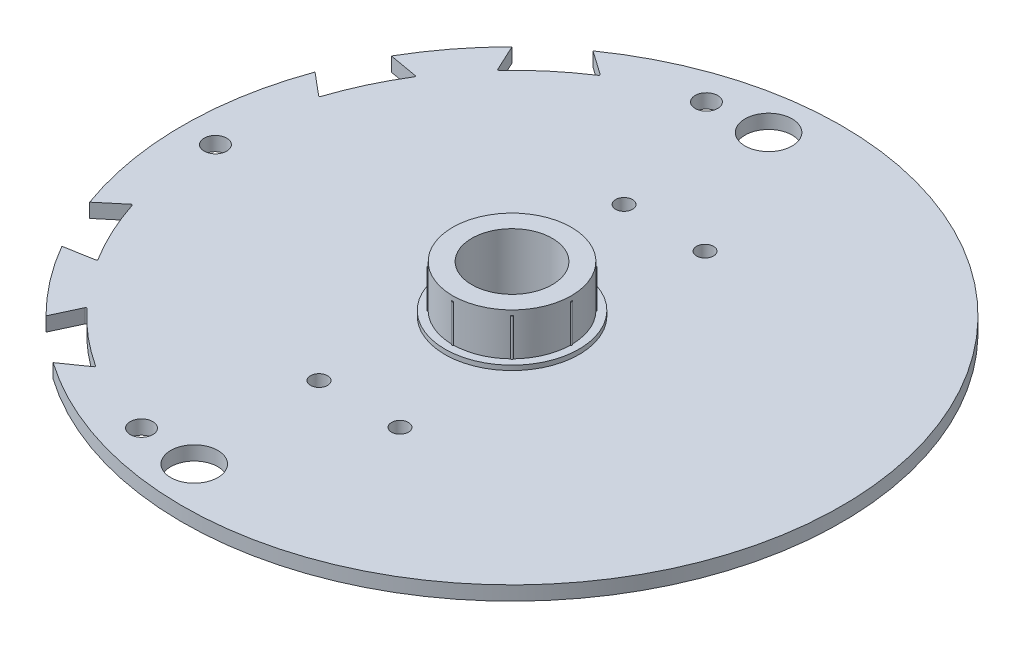
from build123d import *

# Parameters (mm, degrees)
SKETCH1_R                      = 70
BASE_PLATE_DEPTH               = 3
SKETCH2_R                      = 14.25
BEARING_STEPUP_DEPTH           = 1
SKETCH3_R                      = 12.6
BEARING_SITTING_DEPTH          = 9
SKETCH4_R                      = 0.2
BEARING_SITTING_GRID_DEPTH     = 8
SKETCH5_R                      = 2.4
M4_SCREW_CLEARANCE_HOLES_DEPTH = 100.844879688
SKETCH6_R                      = 5
HOLES_RESERVED_FOR_RODS_DEPTH  = 100.844879688
SKETCH8_R                      = 8.55
CUT_EXTRUDE1_DEPTH             = 100.844879688
CUT_EXTRUDE2_REACH             = 101.499
SKETCH9_R                      = 1.8
CUT_EXTRUDE3_DEPTH             = 100.498743711


with BuildPart() as part:
    # Sketch1 → base-plate (new body)
    with BuildSketch(Plane(origin=(0, 0, 0), x_dir=(1, 0, 0), z_dir=(0, 1, 0))):
        Circle(SKETCH1_R)
    extrude(amount=BASE_PLATE_DEPTH)

    # Sketch2 → bearing-stepup (add)
    with BuildSketch(Plane(origin=(0, 3, 0), x_dir=(1, 0, 0), z_dir=(0, 1, 0))):
        Circle(SKETCH2_R)
    extrude(amount=BEARING_STEPUP_DEPTH)

    # Sketch3 → bearing-sitting (add)
    with BuildSketch(Plane(origin=(0, 4, 0), x_dir=(1, 0, 0), z_dir=(0, 1, 0))):
        Circle(SKETCH3_R)
    extrude(amount=BEARING_SITTING_DEPTH)

    # Sketch4 → bearing-sitting-grid (add)
    with BuildSketch(Plane(origin=(0, 4, 0), x_dir=(1, 0, 0), z_dir=(0, 1, 0))):
        with Locations((0, 12.6)):
            Circle(SKETCH4_R)
        with Locations((8.909545443, 8.909545443)):
            Circle(SKETCH4_R)
        with Locations((12.6, 0)):
            Circle(SKETCH4_R)
        with Locations((8.909545443, -8.909545443)):
            Circle(SKETCH4_R)
        with Locations((0, -12.6)):
            Circle(SKETCH4_R)
        with Locations((-8.909545443, -8.909545443)):
            Circle(SKETCH4_R)
        with Locations((-12.6, 0)):
            Circle(SKETCH4_R)
        with Locations((-8.909545443, 8.909545443)):
            Circle(SKETCH4_R)
    extrude(amount=BEARING_SITTING_GRID_DEPTH)

    # Sketch5 → m4-screw-clearance-holes (cut, through all)
    with BuildSketch(Plane.XZ):
        with Locations((-18.7, 60)):
            Circle(SKETCH5_R)
        with Locations((-63, 0)):
            Circle(SKETCH5_R)
        with Locations((-18.7, -60)):
            Circle(SKETCH5_R)
    extrude(amount=-M4_SCREW_CLEARANCE_HOLES_DEPTH, mode=Mode.SUBTRACT)

    # Sketch6 → holes-reserved-for-rods (cut, through all)
    with BuildSketch(Plane.XZ):
        with Locations((-6.5, 61)):
            Circle(SKETCH6_R)
        with Locations((-6.5, -61)):
            Circle(SKETCH6_R)
    extrude(amount=-HOLES_RESERVED_FOR_RODS_DEPTH, mode=Mode.SUBTRACT)

    # Sketch8 → Cut-Extrude1 (cut, through all)
    with BuildSketch(Plane(origin=(0, 13, 0), x_dir=(1, 0, 0), z_dir=(0, 1, 0))):
        Circle(SKETCH8_R)
    extrude(amount=-CUT_EXTRUDE1_DEPTH, mode=Mode.SUBTRACT)

    # Sketch9 → Cut-Extrude2 (cut, up to next)
    with BuildSketch(Plane(origin=(0, 3, 0), x_dir=(1, 0, 0), z_dir=(0, 1, 0)), mode=Mode.PRIVATE) as cut_extrude2_sk1:
        with Locations((-8.6, 32.4)):
            Circle(SKETCH9_R)
    cut_extrude2_tool1 = extrude(cut_extrude2_sk1.sketch, amount=-CUT_EXTRUDE2_REACH, mode=Mode.PRIVATE) & part.part
    # Sketch9 → Cut-Extrude2 (cut, up to next)
    with BuildSketch(Plane(origin=(0, 3, 0), x_dir=(1, 0, 0), z_dir=(0, 1, 0)), mode=Mode.PRIVATE) as cut_extrude2_sk2:
        with Locations((8.6, 32.4)):
            Circle(SKETCH9_R)
    cut_extrude2_tool2 = extrude(cut_extrude2_sk2.sketch, amount=-CUT_EXTRUDE2_REACH, mode=Mode.PRIVATE) & part.part
    # Sketch9 → Cut-Extrude2 (cut, up to next)
    with BuildSketch(Plane(origin=(0, 3, 0), x_dir=(1, 0, 0), z_dir=(0, 1, 0)), mode=Mode.PRIVATE) as cut_extrude2_sk3:
        with Locations((8.6, -32.4)):
            Circle(SKETCH9_R)
    cut_extrude2_tool3 = extrude(cut_extrude2_sk3.sketch, amount=-CUT_EXTRUDE2_REACH, mode=Mode.PRIVATE) & part.part
    # Sketch9 → Cut-Extrude2 (cut, up to next)
    with BuildSketch(Plane(origin=(0, 3, 0), x_dir=(1, 0, 0), z_dir=(0, 1, 0)), mode=Mode.PRIVATE) as cut_extrude2_sk4:
        with Locations((-8.6, -32.4)):
            Circle(SKETCH9_R)
    cut_extrude2_tool4 = extrude(cut_extrude2_sk4.sketch, amount=-CUT_EXTRUDE2_REACH, mode=Mode.PRIVATE) & part.part
    add(cut_extrude2_tool1.solids().sort_by_distance((-8.6, 3, -32.4))[0], mode=Mode.SUBTRACT)
    add(cut_extrude2_tool2.solids().sort_by_distance((8.6, 3, -32.4))[0], mode=Mode.SUBTRACT)
    add(cut_extrude2_tool3.solids().sort_by_distance((8.6, 3, 32.4))[0], mode=Mode.SUBTRACT)
    add(cut_extrude2_tool4.solids().sort_by_distance((-8.6, 3, 32.4))[0], mode=Mode.SUBTRACT)

    # Sketch10 → Cut-Extrude3 (cut, through all)
    with BuildSketch(Plane(origin=(0, 3, 0), x_dir=(1, 0, 0), z_dir=(0, 1, 0))):
        with BuildLine():
            Line((-35.036750707, 53.76592401), (-40.233330852, 57.4046086))
            ThreePointArc((-40.233330852, 57.4046086), (-45.059411439, 53.699715463), (-49.546059024, 49.590301826))
            Line((-49.546059024, 49.590301826), (-46.865030901, 43.840818462))
            ThreePointArc((-46.865030901, 43.840818462), (-46.715497934, 43.72787491), (-46.538110157, 43.788289565))
            ThreePointArc((-46.538110157, 43.788289565), (-41.074128259, 48.950239915), (-35.041789034, 53.434848379))
            ThreePointArc((-35.041789034, 53.434848379), (-34.951489149, 53.599050343), (-35.036750707, 53.76592401))
        make_face()
        with BuildLine():
            Line((-65.861746267, 24.005007365), (-61.002072937, 19.927257266))
            ThreePointArc((-61.002072937, 19.927257266), (-60.818818038, 19.888091008), (-60.68358245, 20.017812594))
            ThreePointArc((-60.68358245, 20.017812594), (-57.913067592, 27.005306925), (-54.341189011, 33.619119216))
            ThreePointArc((-54.341189011, 33.619119216), (-54.328744272, 33.806099114), (-54.476541344, 33.921304927))
            Line((-54.476541344, 33.921304927), (-60.724016952, 35.022903438))
            ThreePointArc((-60.724016952, 35.022903438), (-63.532175871, 29.625540148), (-65.861746267, 24.005007365))
        make_face()
        with BuildLine():
            Line((-46.865030901, -43.840818462), (-49.546059024, -49.590301826))
            ThreePointArc((-49.546059024, -49.590301826), (-45.059411439, -53.699715463), (-40.233330852, -57.4046086))
            Line((-40.233330852, -57.4046086), (-35.036750707, -53.76592401))
            ThreePointArc((-35.036750707, -53.76592401), (-34.951489149, -53.599050343), (-35.041789034, -53.434848379))
            ThreePointArc((-35.041789034, -53.434848379), (-41.074128259, -48.950239915), (-46.538110157, -43.788289565))
            ThreePointArc((-46.538110157, -43.788289565), (-46.715497934, -43.72787491), (-46.865030901, -43.840818462))
        make_face()
        with BuildLine():
            Line((-60.724016952, -35.022903438), (-54.476541344, -33.921304927))
            ThreePointArc((-54.476541344, -33.921304927), (-54.328744272, -33.806099114), (-54.341189011, -33.619119216))
            ThreePointArc((-54.341189011, -33.619119216), (-57.913067592, -27.005306925), (-60.68358245, -20.017812594))
            ThreePointArc((-60.68358245, -20.017812594), (-60.818818038, -19.888091008), (-61.002072937, -19.927257266))
            Line((-61.002072937, -19.927257266), (-65.861746267, -24.005007365))
            ThreePointArc((-65.861746267, -24.005007365), (-63.532175871, -29.625540148), (-60.724016952, -35.022903438))
        make_face()
    extrude(amount=-CUT_EXTRUDE3_DEPTH, mode=Mode.SUBTRACT)


solid = part.part
